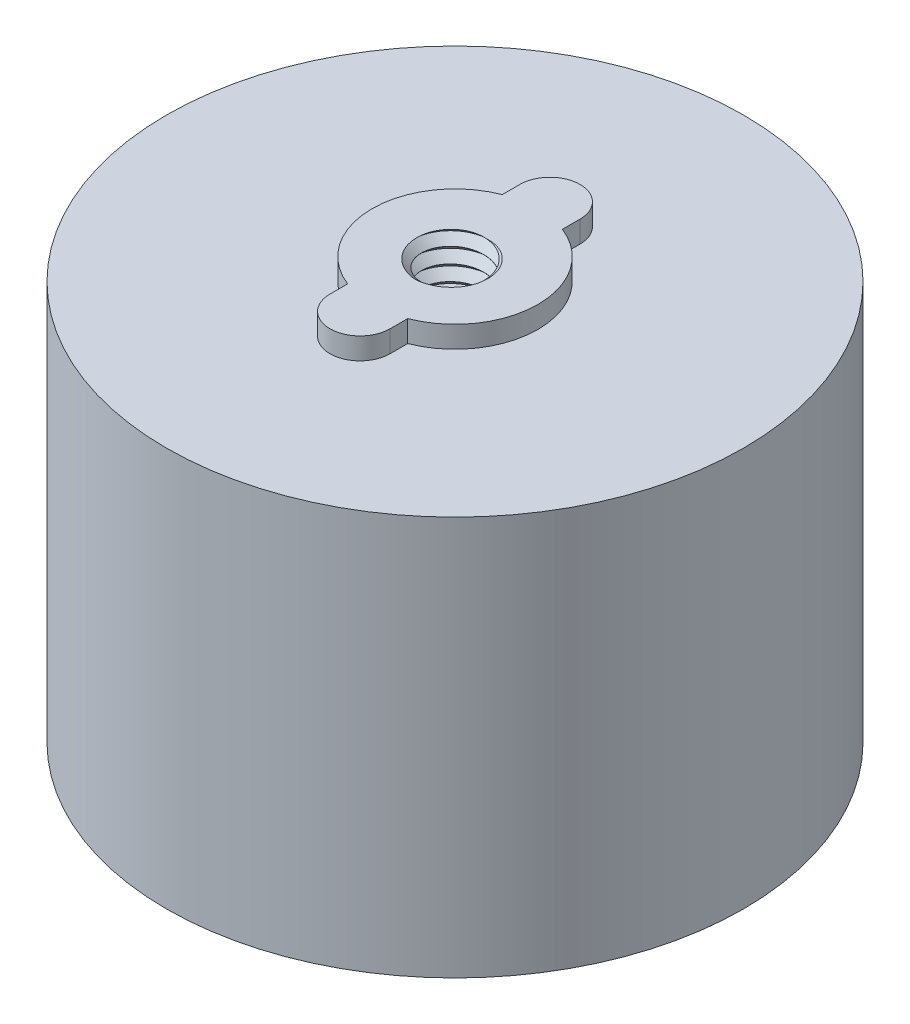
from build123d import *

# Parameters (mm, degrees)
SKETCH_1_R               = 24
SKETCH_1_R_2             = 1.7
EXTRUDE_1_DEPTH          = 25
EXTRUDE_START            = 10
SKETCH_1_2_R             = 24
EXTRUDE_2_DEPTH          = 10
SKETCH_2_R               = 24
CUT_EXTRUDE_1_DEPTH      = 1.8
SKETCH_3_2_R             = 2.6
CUT_EXTRUDE_2_DEPTH      = 15
SWEEP_1_PITCH            = 1.27
SWEEP_2_PITCH            = 0.7
PATTERN_CIRCULAR_2_COUNT = 2
SKETCH_8_R               = 5.1
CUT_EXTRUDE_3_DEPTH      = 10
FILLET_1_R               = 5


with BuildPart() as part:
    # 草图1 → 凸台-拉伸1 (new body)
    with BuildSketch(Plane(origin=(0, 0, 0), x_dir=(1, 0, 0), z_dir=(0, 1, 0))):
        with Locations(Location((0, 0, 0), (0, 0, 270))):
            Circle(SKETCH_1_R)
        with Locations(Location((0, 16, 0), (0, 0, 270))):
            Circle(SKETCH_1_R_2, mode=Mode.SUBTRACT)
        with Locations(Location((0, -16, 0), (0, 0, 270))):
            Circle(SKETCH_1_R_2, mode=Mode.SUBTRACT)
    extrude(amount=-EXTRUDE_1_DEPTH)

    # 草图1<2> → 凸台-拉伸2 (add)
    with BuildSketch(Plane(origin=(0, 0, 0), x_dir=(1, 0, 0), z_dir=(0, 1, 0)).offset(EXTRUDE_START)):
        with Locations(Location((0, 0, 0), (0, 0, 270))):
            Circle(SKETCH_1_2_R)
    extrude(amount=-EXTRUDE_2_DEPTH)

    # 草图2 → 切除-拉伸1 (cut)
    with BuildSketch(Plane(origin=(0, 10, 0), x_dir=(1, 0, 0), z_dir=(0, 1, 0))):
        with Locations(Location((0, 0, 0), (0, 0, 270))):
            Circle(SKETCH_2_R)
        with BuildLine():
            ThreePointArc((-2.5, 7.9), (0, 10.4), (2.5, 7.9))
            Line((2.5, 7.9), (2.5, 6.431174076))
            ThreePointArc((2.5, 6.431174076), (5.69473441, 3.896151948), (6.9, 0))
            ThreePointArc((6.9, 0), (5.69473441, -3.896151948), (2.5, -6.431174076))
            Line((2.5, -6.431174076), (2.5, -7.9))
            ThreePointArc((2.5, -7.9), (0, -10.4), (-2.5, -7.9))
            Line((-2.5, -7.9), (-2.5, -6.431174076))
            ThreePointArc((-2.5, -6.431174076), (-6.9, 0), (-2.5, 6.431174076))
            Line((-2.5, 6.431174076), (-2.5, 7.9))
        make_face(mode=Mode.SUBTRACT)
    extrude(amount=-CUT_EXTRUDE_1_DEPTH, mode=Mode.SUBTRACT)

    # 草图3<2> → 切除-拉伸2 (cut)
    with BuildSketch(Plane(origin=(0, 10, 0), x_dir=(1, 0, 0), z_dir=(0, 1, 0))):
        with Locations(Location((0, 0, 0), (0, 0, 270))):
            Circle(SKETCH_3_2_R)
    extrude(amount=-CUT_EXTRUDE_2_DEPTH, mode=Mode.SUBTRACT)

    # 切除-扫描1: arcs per turn and ends read off the stored shape
    # 切除-扫描1: the profile of 草图4 screwed along a right-hand helix through 13 turns, 8 arcs to a turn; built about Z, then put on its axis
    sweep_1_z = Axis((0, 0, 0), (0, 0, 1))
    sweep_1_corners = [(2.6, 0, -1.27), (2.6, 0, -0.64), (3.3, 0, -1.27), (2.6, 0, -1.9)]
    with BuildLine(mode=Mode.PRIVATE) as sweep_1_profile:
        Line(sweep_1_corners[0], sweep_1_corners[1])
        Line(sweep_1_corners[1], sweep_1_corners[2])
        Line(sweep_1_corners[2], sweep_1_corners[3])
        Line(sweep_1_corners[3], sweep_1_corners[0])
    sweep_1_cap = Face(sweep_1_profile.wire())
    sweep_1_turn_angles = [0, 22.5, 45, 67.5, 90, 112.5, 135, 157.5, 180, 202.5, 225, 247.5, 270, 292.5, 315, 337.5, 360]
    sweep_1_turn_weights = [1, 0.9238795325112867, 1, 0.9238795325112867, 1, 0.9238795325112867, 1, 0.9238795325112867, 1, 0.9238795325112867, 1, 0.9238795325112867, 1, 0.9238795325112867, 1, 0.9238795325112867, 1]
    sweep_1_turn_rails = [Edge.make_bspline([Vector(p[0], p[1], 0).rotate(sweep_1_z, sweep_1_turn_angles[k]) / sweep_1_turn_weights[k] + Vector(0, 0, p[2] + SWEEP_1_PITCH * sweep_1_turn_angles[k] / 360) for k in range(17)], [0, 0, 0, 1, 1, 2, 2, 3, 3, 4, 4, 5, 5, 6, 6, 7, 7, 8, 8, 8], 2, sweep_1_turn_weights) for p in sweep_1_corners]
    sweep_1_turn_sides = [Face.make_surface_from_curves(sweep_1_turn_rails[p[0]], sweep_1_turn_rails[p[1]]) for p in [(0, 1), (1, 2), (2, 3), (3, 0)]]
    sweep_1 = Plane(origin=(0, 10, 0), x_dir=(0, 0, 1), z_dir=(0, -1, 0)) * Solid(Shell([*[p.moved(Location((0, 0, SWEEP_1_PITCH * i))) for i in range(13) for p in sweep_1_turn_sides], sweep_1_cap, sweep_1_cap.rotate(sweep_1_z, 4680).moved(Location((0, 0, SWEEP_1_PITCH * 4680 / 360)))]))
    add(sweep_1, mode=Mode.SUBTRACT)

    # 切除-扫描2: arcs per turn and ends read off the stored shape
    # 切除-扫描2: the profile of 草图7 screwed along a right-hand helix through 36.75 turns, 6 arcs to a turn; built about Z, then put on its axis
    sweep_2_z = Axis((0, 0, 0), (0, 0, 1))
    sweep_2_corners = [(1.7, 0, -0.7), (1.7, 0, -0.351), (2, 0, -0.7), (1.7, 0, -1.049)]
    with BuildLine(mode=Mode.PRIVATE) as sweep_2_profile:
        Line(sweep_2_corners[0], sweep_2_corners[1])
        Line(sweep_2_corners[1], sweep_2_corners[2])
        Line(sweep_2_corners[2], sweep_2_corners[3])
        Line(sweep_2_corners[3], sweep_2_corners[0])
    sweep_2_cap = Face(sweep_2_profile.wire())
    sweep_2_turn_angles = [0, 30, 60, 90, 120, 150, 180, 210, 240, 270, 300, 330, 360]
    sweep_2_turn_weights = [1, 0.8660254037844387, 1, 0.8660254037844387, 1, 0.8660254037844387, 1, 0.8660254037844387, 1, 0.8660254037844387, 1, 0.8660254037844387, 1]
    sweep_2_turn_rails = [Edge.make_bspline([Vector(p[0], p[1], 0).rotate(sweep_2_z, sweep_2_turn_angles[k]) / sweep_2_turn_weights[k] + Vector(0, 0, p[2] + SWEEP_2_PITCH * sweep_2_turn_angles[k] / 360) for k in range(13)], [0, 0, 0, 1, 1, 2, 2, 3, 3, 4, 4, 5, 5, 6, 6, 6], 2, sweep_2_turn_weights) for p in sweep_2_corners]
    sweep_2_turn_sides = [Face.make_surface_from_curves(sweep_2_turn_rails[p[0]], sweep_2_turn_rails[p[1]]) for p in [(0, 1), (1, 2), (2, 3), (3, 0)]]
    sweep_2_last_angles = [12960, 12990, 13020, 13050, 13080, 13110, 13140, 13170, 13200, 13215, 13230]
    sweep_2_last_weights = [1, 0.8660254037844387, 1, 0.8660254037844387, 1, 0.8660254037844387, 1, 0.8660254037844387, 1, 0.9659258262890683, 1]
    sweep_2_last_rails = [Edge.make_bspline([Vector(p[0], p[1], 0).rotate(sweep_2_z, sweep_2_last_angles[k]) / sweep_2_last_weights[k] + Vector(0, 0, p[2] + SWEEP_2_PITCH * sweep_2_last_angles[k] / 360) for k in range(11)], [0, 0, 0, 1, 1, 2, 2, 3, 3, 4, 4, 5, 5, 5], 2, sweep_2_last_weights) for p in sweep_2_corners]
    sweep_2_last_sides = [Face.make_surface_from_curves(sweep_2_last_rails[p[0]], sweep_2_last_rails[p[1]]) for p in [(0, 1), (1, 2), (2, 3), (3, 0)]]
    sweep_2 = Plane(origin=(0, -25, 16), x_dir=(0, 0, -1), z_dir=(0, 1, 0)) * Solid(Shell([*[p.moved(Location((0, 0, SWEEP_2_PITCH * i))) for i in range(36) for p in sweep_2_turn_sides], *sweep_2_last_sides, sweep_2_cap, sweep_2_cap.rotate(sweep_2_z, 13230).moved(Location((0, 0, SWEEP_2_PITCH * 13230 / 360)))]))
    add(sweep_2, mode=Mode.SUBTRACT)

    # 阵列(圆周)2: 切除-扫描2 ×2 about axis
    pattern_circular_2_axis = Axis((0, -25, 0), (0, 1, 0))
    for i in range(1, PATTERN_CIRCULAR_2_COUNT):
        add(sweep_2.rotate(pattern_circular_2_axis, i * 360 / PATTERN_CIRCULAR_2_COUNT), mode=Mode.SUBTRACT)

    # 草图8 → 切除-拉伸3 (cut)
    with BuildSketch(Plane.XZ.offset(25)):
        with Locations(Location((0, 0, 0), (0, 0, 270))):
            Circle(SKETCH_8_R)
    extrude(amount=-CUT_EXTRUDE_3_DEPTH, mode=Mode.SUBTRACT)

    # 圆角1
    fillet_1_edges = [part.edges().sort_by_distance(p)[0] for p in [
        (0, -15, 5.1),
    ]]
    fillet(fillet_1_edges, radius=FILLET_1_R)


solid = part.part
